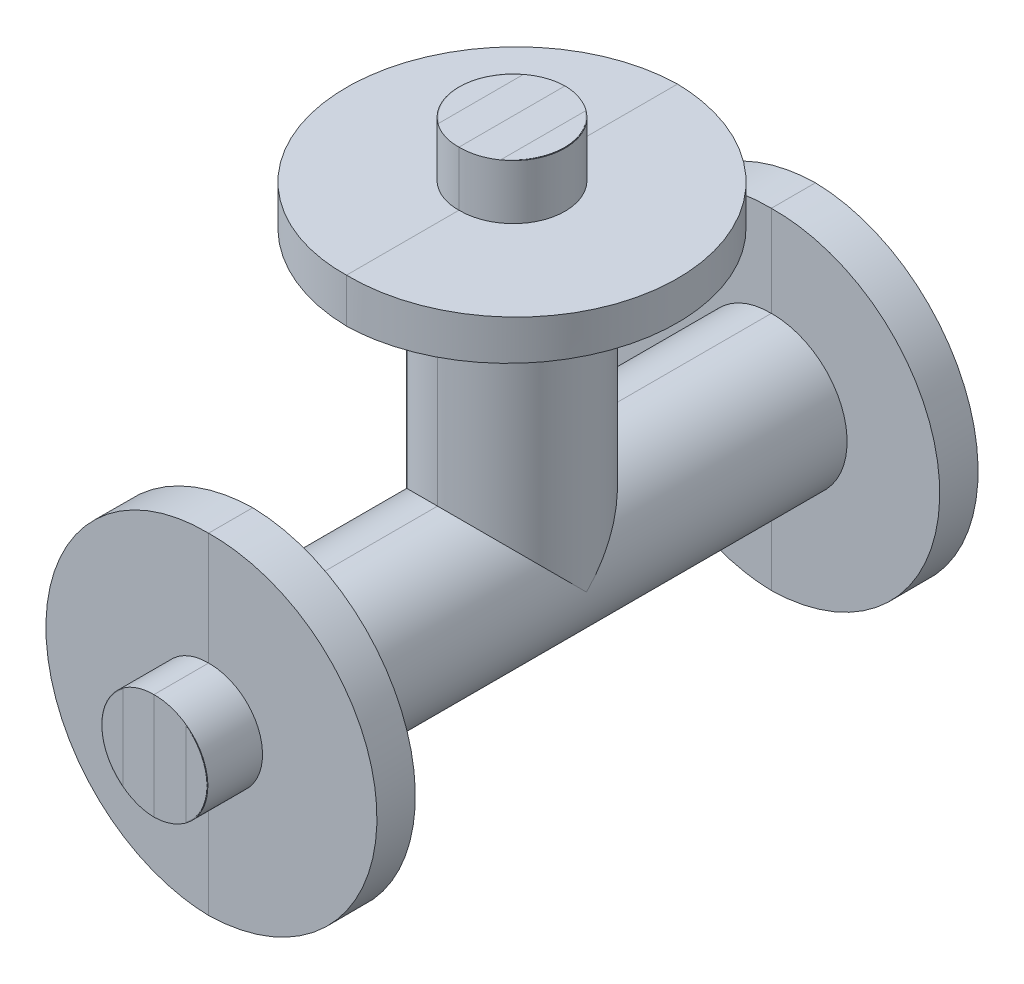
from build123d import *

# Parameters (mm, degrees)
SKETCH1_R                = 27
SKETCH1_R_2              = 22
BOSS_EXTRUDE1_DEPTH      = 94
SKETCH2_R                = 60
SKETCH2_R_2              = 22
BOSS_EXTRUDE2_DEPTH      = 16
BOSS_EXTRUDE3_REACH      = 205.224
BOSS_EXTRUDE3_END_RADIUS = 27
SKETCH3_R                = 27
SKETCH3_R_2              = 22
SKETCH4_R                = 22
CUT_EXTRUDE5_DEPTH       = 100
BOSS_EXTRUDE4_START      = 16
SKETCH6_R                = 60
SKETCH6_R_2              = 22
BOSS_EXTRUDE4_DEPTH      = 16
SCALE1_SCALE             = 1.01
MOVE_START               = 18.914152479
MOVE_FACE1_OUTLINE_R     = 22.22
MOVE_FACE1_OUTLINE_R_2   = 19.22
MOVE_FACE1_DEPTH         = 97.9399999
MOVE_START_2             = -111.1
MOVE_FACE1_2_OUTLINE_R   = 19.22
MOVE_FACE1_2_DEPTH       = 222.2
MOVE_FACE1_3_DEPTH       = 91.8799999
MOVE_START_3             = 19.2200001
MOVE_FACE1_4_DEPTH       = 91.8799999
MOVE_START_4             = -0.305847721
MOVE_FACE1_5_OUTLINE_R   = 19.22
MOVE_FACE1_5_DEPTH       = 19.220000155
MOVE_START_5             = 11.257393302
MOVE_FACE1_6_DEPTH       = 7.656759132
SKETCH7_R                = 19.42
BOSS_EXTRUDE5_DEPTH      = 20
SKETCH8_R                = 19.42
BOSS_EXTRUDE6_DEPTH      = 20
SKETCH10_R               = 19.42
BOSS_EXTRUDE7_DEPTH      = 20
SHELL1_T                 = -0.2
SHELL2_T                 = -0.2
SHELL3_T                 = -0.2
SPLIT1_SURFACE_1_BACK    = 351.068
SPLIT1_SURFACE_1_DEPTH   = 702.136
SPLIT1_SURFACE_2_BACK    = 351.068
SPLIT1_SURFACE_2_DEPTH   = 702.136
DRAFT11_ANGLE            = 1
DRAFT12_ANGLE            = -1


with BuildPart() as part:
    # Sketch1 → Boss-Extrude1 (new, symmetric)
    with BuildSketch(Plane.XY):
        Circle(SKETCH1_R)
        Circle(SKETCH1_R_2, mode=Mode.SUBTRACT)
    extrude(amount=BOSS_EXTRUDE1_DEPTH, both=True)

    # Sketch2 → Boss-Extrude2 (add)
    with BuildSketch(Plane.XY.offset(94)):
        Circle(SKETCH2_R)
        Circle(SKETCH2_R_2, mode=Mode.SUBTRACT)
    boss_extrude2 = extrude(amount=BOSS_EXTRUDE2_DEPTH)

    # Mirror1: Boss-Extrude2 across plane
    add(boss_extrude2.mirror(Plane.XY))

    # Boss-Extrude3: up to this cylinder (the profile starts outside it)
    boss_extrude3_end = Plane(origin=(0, 0, -26.236325), z_dir=(0, 0, -1)) * Cylinder(BOSS_EXTRUDE3_END_RADIUS, 465.448, mode=Mode.PRIVATE)
    # Sketch3 → Boss-Extrude3 (add, up to the surface)
    with BuildSketch(Plane(origin=(0, 100, 0), x_dir=(1, 0, 0), z_dir=(0, 1, 0)), mode=Mode.PRIVATE) as boss_extrude3_sk1:
        with Locations(Location((0, 0, 0), (0, 0, 270))):
            Circle(SKETCH3_R)
        with Locations(Location((0, 0, 0), (0, 0, 270))):
            Circle(SKETCH3_R_2, mode=Mode.SUBTRACT)
    boss_extrude3_tool1 = extrude(boss_extrude3_sk1.sketch, amount=-BOSS_EXTRUDE3_REACH, mode=Mode.PRIVATE) - boss_extrude3_end
    add(boss_extrude3_tool1.solids().sort_by_distance((0, 100, -26.236325))[0])

    # Sketch4 → Cut-Extrude5 (cut)
    with BuildSketch(Plane(origin=(0, 100, 0), x_dir=(1, 0, 0), z_dir=(0, 1, 0))):
        with Locations(Location((0, 0, 0), (0, 0, 270))):
            Circle(SKETCH4_R)
    extrude(amount=-CUT_EXTRUDE5_DEPTH, mode=Mode.SUBTRACT)

    # Sketch6 → Boss-Extrude4 (add)
    with BuildSketch(Plane(origin=(0, 100, 0), x_dir=(1, 0, 0), z_dir=(0, 1, 0)).offset(BOSS_EXTRUDE4_START)):
        with Locations(Location((0, 0, 0), (0, 0, 270))):
            Circle(SKETCH6_R)
        with Locations(Location((0, 0, 0), (0, 0, 270))):
            Circle(SKETCH6_R_2, mode=Mode.SUBTRACT)
    extrude(amount=-BOSS_EXTRUDE4_DEPTH)


with BuildPart() as part_1:
    # Scale1: scaled about (0, 30.584762689, 0)
    add(part.part.scale(SCALE1_SCALE).moved(Location((0, -0.305847627, 0))))

    # Move Face1: read off the stored shape, not the designer's step
    # Move Face1 outline → Move Face1 (add)
    with BuildSketch(Plane(origin=(0, 0, 0), x_dir=(1, 0, 0), z_dir=(0, 1, 0)).offset(MOVE_START)):
        with Locations((6e-09, 0)):
            Circle(MOVE_FACE1_OUTLINE_R)
        with Locations((6e-09, 0)):
            Circle(MOVE_FACE1_OUTLINE_R_2, mode=Mode.SUBTRACT)
    extrude(amount=MOVE_FACE1_DEPTH)

    # Move Face1 2 outline → Move Face1 2 (add)
    with BuildSketch(Plane.XY.offset(MOVE_START_2)):
        with BuildLine():
            Line((6e-09, 18.914152429), (-19.345399865, 18.914152479))
            ThreePointArc((-19.345399865, 18.914152479), (6e-09, -27.575847621), (19.345399877, 18.914152479))
            Line((19.345399877, 18.914152479), (6e-09, 18.914152429))
        make_face()
        with Locations((6e-09, -0.305847621)):
            Circle(MOVE_FACE1_2_OUTLINE_R, mode=Mode.SUBTRACT)
    extrude(amount=MOVE_FACE1_2_DEPTH)

    # Move Face1 3 outline → Move Face1 3 (add)
    with BuildSketch(Plane.XY.offset(MOVE_START_2)):
        with BuildLine():
            Line((-11.149887713, 18.914152479), (11.149887725, 18.914152479))
            ThreePointArc((11.149887725, 18.914152479), (6e-09, 21.914152379), (-11.149887713, 18.914152479))
        make_face()
    extrude(amount=MOVE_FACE1_3_DEPTH)

    # Move Face1 4 outline → Move Face1 4 (add)
    with BuildSketch(Plane.XY.offset(MOVE_START_3)):
        with BuildLine():
            Line((-11.149887713, 18.914152479), (11.149887725, 18.914152479))
            ThreePointArc((11.149887725, 18.914152479), (6e-09, 21.914152379), (-11.149887713, 18.914152479))
        make_face()
    extrude(amount=MOVE_FACE1_4_DEPTH)

    # Move Face1 5 outline → Move Face1 5 (cut)
    with BuildSketch(Plane(origin=(0, 0, 0), x_dir=(1, 0, 0), z_dir=(0, 1, 0)).offset(MOVE_START_4)):
        with Locations((6e-09, 0)):
            Circle(MOVE_FACE1_5_OUTLINE_R)
    extrude(amount=MOVE_FACE1_5_DEPTH, mode=Mode.SUBTRACT)

    # Move Face1 6 outline → Move Face1 6 (add)
    with BuildSketch(Plane(origin=(0, 0, 0), x_dir=(1, 0, 0), z_dir=(0, 1, 0)).offset(MOVE_START_5)):
        with BuildLine():
            ThreePointArc((19.345399877, -10.930869308), (22.220000006, 0), (19.345399877, 10.930869308))
            Line((19.345399877, 10.930869308), (19.345399877, -10.930869308))
        make_face()
        with BuildLine():
            Line((-19.345399865, -10.930869308), (-19.345399865, 10.930869308))
            ThreePointArc((-19.345399865, 10.930869308), (-22.219999994, 0), (-19.345399865, -10.930869308))
        make_face()
    extrude(amount=MOVE_FACE1_6_DEPTH)


with BuildPart() as body_2:
    # Sketch7 → Boss-Extrude5 (new body)
    with BuildSketch(Plane(origin=(0, 116.854152379, 0), x_dir=(1, 0, 0), z_dir=(0, 1, 0))):
        with Locations(Location((6e-09, 0, 0), (0, 0, 270))):
            Circle(SKETCH7_R)
    extrude(amount=BOSS_EXTRUDE5_DEPTH)

    # Shell1
    shell1_openings = [body_2.faces().sort_by_distance(p)[0] for p in [
        (6e-09, 116.854152379, 0),
    ]]
    offset(amount=SHELL1_T, openings=shell1_openings, kind=Kind.INTERSECTION)


with BuildPart() as body_3:
    # Sketch8 → Boss-Extrude6 (new body)
    with BuildSketch(Plane(origin=(0, 0, -111.1), x_dir=(-1, 0, 0), z_dir=(0, 0, -1))):
        with Locations((-6e-09, -0.305847621)):
            Circle(SKETCH8_R)
    extrude(amount=BOSS_EXTRUDE6_DEPTH)

    # Shell2
    shell2_openings = [body_3.faces().sort_by_distance(p)[0] for p in [
        (6e-09, -0.305847621, -111.1),
    ]]
    offset(amount=SHELL2_T, openings=shell2_openings, kind=Kind.INTERSECTION)


with BuildPart() as body_4:
    # Sketch10 → Boss-Extrude7 (new body)
    with BuildSketch(Plane.XY.offset(111.1)):
        with Locations(Location((6e-09, -0.305847621, 0), (0, 0, 180))):
            Circle(SKETCH10_R)
    extrude(amount=BOSS_EXTRUDE7_DEPTH)

    # Shell3
    shell3_openings = [body_4.faces().sort_by_distance(p)[0] for p in [
        (6e-09, -0.305847621, 111.1),
    ]]
    offset(amount=SHELL3_T, openings=shell3_openings, kind=Kind.INTERSECTION)

    # Combine6: union body 2, body 3, part
    add(body_2.part)
    add(body_3.part)
    add(part_1.part)


with BuildPart() as body_2_2:
    # Split1: the piece behind the surface
    add(body_4.part)
    # Split1 surface: a surface, the sketch's curves swept straight by 702.136 mm
    with BuildLine(Plane.XY.offset(-SPLIT1_SURFACE_1_BACK), mode=Mode.PRIVATE) as split1_surface_1_path:
        Line((0, 140.918686574), (0, -64.970381816))
    split1_surface_1 = Shell.extrude(split1_surface_1_path.wire(), (0 * SPLIT1_SURFACE_1_DEPTH, 0 * SPLIT1_SURFACE_1_DEPTH, 1 * SPLIT1_SURFACE_1_DEPTH))
    split(bisect_by=split1_surface_1, keep=Keep.BOTTOM)

    # Draft12
    draft12_faces = [body_2_2.faces().sort_by_distance(p)[0] for p in [
        (-29.311291464, -0.305847627, 94.94),
        (-8.242103984, -0.305847621, 131.1),
        (-27.719709478, -0.305847628, 111.1),
        (-29.311291464, -0.305847627, -94.94),
        (-8.242103984, -0.305847621, -131.1),
        (-27.719709478, -0.305847628, -111.1),
        (-29.311291464, 100.694152373, 0),
        (-8.242103984, 136.854152379, 0),
        (-27.719709478, 116.854152373, 0),
    ]]
    draft(draft12_faces, Plane(origin=(0, 0, 0), x_dir=(0, 0, 1), z_dir=(1, 0, 0)), DRAFT12_ANGLE)


with BuildPart() as body_4_1:
    add(body_4.part)

    # Split1: split by a surface, the side it looks to stays
    # Split1 surface: a surface, the sketch's curves swept straight by 702.136 mm
    with BuildLine(Plane.XY.offset(-SPLIT1_SURFACE_2_BACK), mode=Mode.PRIVATE) as split1_surface_2_path:
        Line((0, 140.918686574), (0, -64.970381816))
    split1_surface_2 = Shell.extrude(split1_surface_2_path.wire(), (0 * SPLIT1_SURFACE_2_DEPTH, 0 * SPLIT1_SURFACE_2_DEPTH, 1 * SPLIT1_SURFACE_2_DEPTH))
    split(bisect_by=split1_surface_2, keep=Keep.TOP)

    # Draft11
    draft11_faces = [body_4_1.faces().sort_by_distance(p)[0] for p in [
        (29.311291464, 100.694152373, 0),
        (8.242103989, -0.305847621, -131.1),
        (8.242103989, -0.305847621, 131.1),
        (27.719709479, -0.305847628, 111.1),
        (29.311291464, -0.305847627, 94.94),
        (29.311291464, -0.305847627, -94.94),
        (27.719709479, -0.305847628, -111.1),
        (8.242103989, 136.854152379, 0),
        (27.719709479, 116.854152373, 0),
    ]]
    draft(draft11_faces, Plane(origin=(0, 0, 0), x_dir=(0, 0, 1), z_dir=(1, 0, 0)), DRAFT11_ANGLE)


solid = Compound([body_2_2.part, body_4_1.part])
